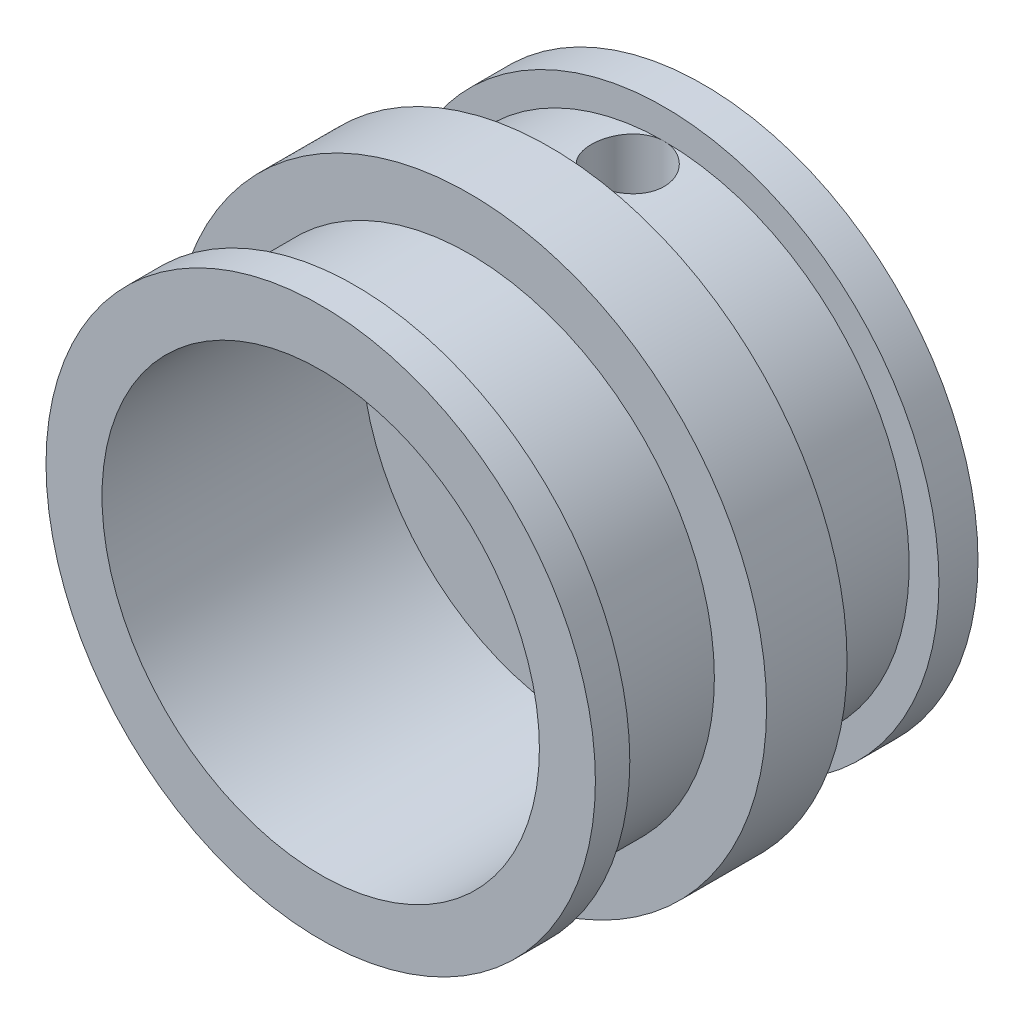
from build123d import *

# Parameters (mm, degrees)
SZKIC1_R                        = 9.42
DODANIE_WYCI_GNI_CIE1_DEPTH     = 1.34
SZKIC2_R                        = 8.4
DODANIE_WYCI_GNI_CIE2_DEPTH     = 3.92
SZKIC3_R                        = 10.19
DODANIE_WYCI_GNI_CIE3_DEPTH     = 2.76
SZKIC4_R                        = 8.4
DODANIE_WYCI_GNI_CIE4_DEPTH     = 3.92
SZKIC5_R                        = 9.42
DODANIE_WYCI_GNI_CIE5_DEPTH     = 1.18
SZKIC6_R                        = 7.5
WYTNIJ_WYCI_GNI_CIE1_DEPTH      = 8.9
WYTNIJ_WYCI_GNI_CIE2_REACH      = 21.489
SZKIC7_R                        = 1.5
WYTNIJ_WYCI_GNI_CIE3_DEPTH      = 20.488627453
WYTNIJ_WYCI_GNI_CIE3_DEPTH_BACK = 20.488627453
SZKIC8_R                        = 1.25


with BuildPart() as part:
    # Szkic1 → Dodanie-wyciągnięcie1 (new body)
    with BuildSketch(Plane.XY):
        Circle(SZKIC1_R)
    extrude(amount=DODANIE_WYCI_GNI_CIE1_DEPTH)

    # Szkic2 → Dodanie-wyciągnięcie2 (add)
    with BuildSketch(Plane.XY.offset(1.34)):
        Circle(SZKIC2_R)
    extrude(amount=DODANIE_WYCI_GNI_CIE2_DEPTH)

    # Szkic3 → Dodanie-wyciągnięcie3 (add)
    with BuildSketch(Plane.XY.offset(5.26)):
        Circle(SZKIC3_R)
    extrude(amount=DODANIE_WYCI_GNI_CIE3_DEPTH)

    # Szkic4 → Dodanie-wyciągnięcie4 (add)
    with BuildSketch(Plane.XY.offset(8.02)):
        Circle(SZKIC4_R)
    extrude(amount=DODANIE_WYCI_GNI_CIE4_DEPTH)

    # Szkic5 → Dodanie-wyciągnięcie5 (add)
    with BuildSketch(Plane.XY.offset(11.94)):
        Circle(SZKIC5_R)
    extrude(amount=DODANIE_WYCI_GNI_CIE5_DEPTH)

    # Szkic6 → Wytnij-wyciągnięcie1 (cut)
    with BuildSketch(Plane.XY.offset(13.12)):
        Circle(SZKIC6_R)
    extrude(amount=-WYTNIJ_WYCI_GNI_CIE1_DEPTH, mode=Mode.SUBTRACT)

    # Szkic7 → Wytnij-wyciągnięcie2 (cut, up to next)
    with BuildSketch(Plane(origin=(0, 0, 0), x_dir=(-1, 0, 0), z_dir=(0, 0, -1)), mode=Mode.PRIVATE) as wytnij_wyci_gni_cie2_sk1:
        Circle(SZKIC7_R)
    wytnij_wyci_gni_cie2_tool1 = extrude(wytnij_wyci_gni_cie2_sk1.sketch, amount=-WYTNIJ_WYCI_GNI_CIE2_REACH, mode=Mode.PRIVATE) & part.part
    add(wytnij_wyci_gni_cie2_tool1.solids().sort_by_distance((0, 0, 0))[0], mode=Mode.SUBTRACT)

    # Szkic8 → Wytnij-wyciągnięcie3 (cut, two sides: drawn at the far end of the back side and taken through both)
    with BuildSketch(Plane(origin=(0, 0, 0), x_dir=(1, 0, 0), z_dir=(0, 1, 0)).offset(-WYTNIJ_WYCI_GNI_CIE3_DEPTH_BACK)):
        with Locations((0, -2.59)):
            Circle(SZKIC8_R)
    extrude(amount=WYTNIJ_WYCI_GNI_CIE3_DEPTH + WYTNIJ_WYCI_GNI_CIE3_DEPTH_BACK, mode=Mode.SUBTRACT)


solid = part.part
